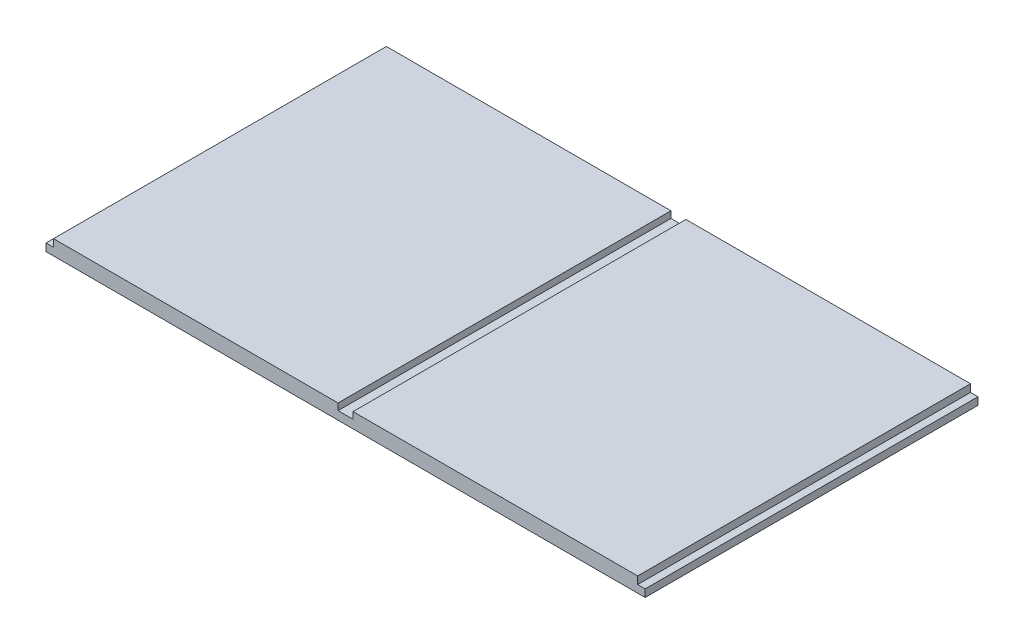
from build123d import *

# Parameters (mm, degrees)
SKETCH1_W           = 720
SKETCH1_H           = 400
BOSS_EXTRUDE1_DEPTH = 18
SKETCH2_W           = 9
SKETCH2_H           = 400
CUT_EXTRUDE1_DEPTH  = 9
SKETCH3_W           = 18
SKETCH3_H           = 400
CUT_EXTRUDE2_DEPTH  = 8


with BuildPart() as part:
    # Sketch1 → Boss-Extrude1 (new body)
    with BuildSketch(Plane(origin=(0, 0, 0), x_dir=(1, 0, 0), z_dir=(0, 1, 0))):
        Rectangle(SKETCH1_W, SKETCH1_H)
    extrude(amount=BOSS_EXTRUDE1_DEPTH)

    # Sketch2 → Cut-Extrude1 (cut)
    with BuildSketch(Plane(origin=(0, 18, 0), x_dir=(1, 0, 0), z_dir=(0, 1, 0))):
        with Locations((355.5, 0)):
            Rectangle(SKETCH2_W, SKETCH2_H)
        with Locations((-355.5, 0)):
            Rectangle(SKETCH2_W, SKETCH2_H)
    extrude(amount=-CUT_EXTRUDE1_DEPTH, mode=Mode.SUBTRACT)

    # Sketch3 → Cut-Extrude2 (cut)
    with BuildSketch(Plane(origin=(0, 18, 0), x_dir=(1, 0, 0), z_dir=(0, 1, 0))):
        Rectangle(SKETCH3_W, SKETCH3_H)
    extrude(amount=-CUT_EXTRUDE2_DEPTH, mode=Mode.SUBTRACT)


solid = part.part
